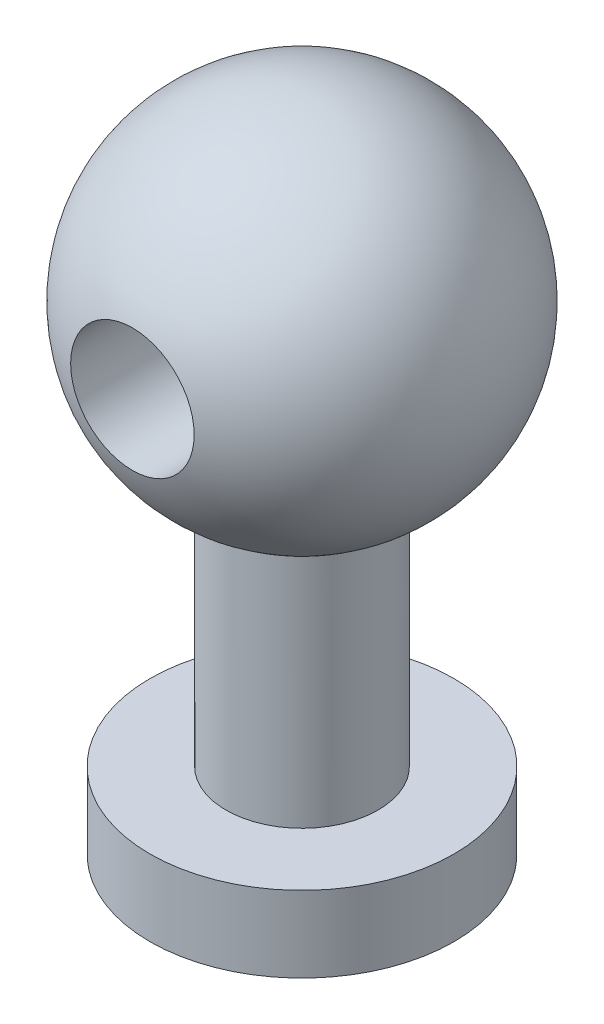
from build123d import *

# Parameters (mm, degrees)
SKETCH2_R          = 3.25
CUT_EXTRUDE1_DEPTH = 20


with BuildPart() as part:
    # Sketch1 → Revolve1 (revolve)
    with BuildSketch(Plane.XY):
        with BuildLine():
            Line((0, 0), (8, 0))
            Line((8, 0), (8, 4))
            Line((8, 4), (4, 4))
            Line((4, 4), (4, 16.58315603))
            ThreePointArc((4, 16.58315603), (9.2765839, 27.248167753), (0, 34.7))
            Line((0, 34.7), (0, 0))
        make_face()
    revolve(axis=Axis((0, 0, 0), (0, 1, 0)))

    # Sketch2 → Cut-Extrude1 (cut, symmetric)
    with BuildSketch(Plane.XY):
        with Locations((0, 25.2)):
            Circle(SKETCH2_R)
    extrude(amount=CUT_EXTRUDE1_DEPTH, both=True, mode=Mode.SUBTRACT)


solid = part.part
